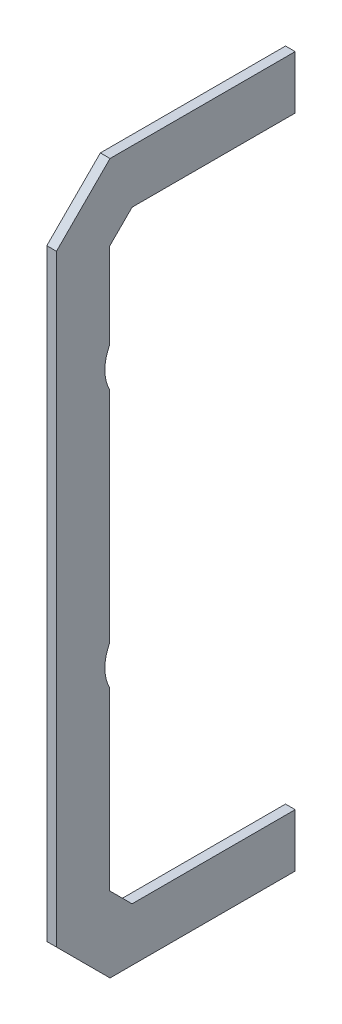
from build123d import *

# Parameters (mm, degrees)
EXTRUDE_THIN1_DEPTH = 3
SKETCH2_R           = 13
CUT_EXTRUDE1_DEPTH  = 133.608446187


with BuildPart() as part:
    # Sketch1 → Extrude-Thin1 (new body)
    with BuildSketch(Plane(origin=(0, 0, 0), x_dir=(0, 0, -1), z_dir=(1, 0, 0))):
        Polygon((74, 110), (16.6, 110), (0, 93.4), (0, -93.4), (16.6, -110), (74, -110), (74, -93.5), (23.434523779, -93.5), (16.5, -86.565476221), (16.5, 86.565476221), (23.434523779, 93.5), (74, 93.5), align=None)
    extrude(amount=EXTRUDE_THIN1_DEPTH)

    # Sketch2 → Cut-Extrude1 (cut, through all)
    with BuildSketch(Plane(origin=(3, 0, 0), x_dir=(0, 0, -1), z_dir=(1, 0, 0))):
        with Locations((28, 54)):
            Circle(SKETCH2_R)
        with Locations((28, -26)):
            Circle(SKETCH2_R)
    extrude(amount=-CUT_EXTRUDE1_DEPTH, mode=Mode.SUBTRACT)


solid = part.part
